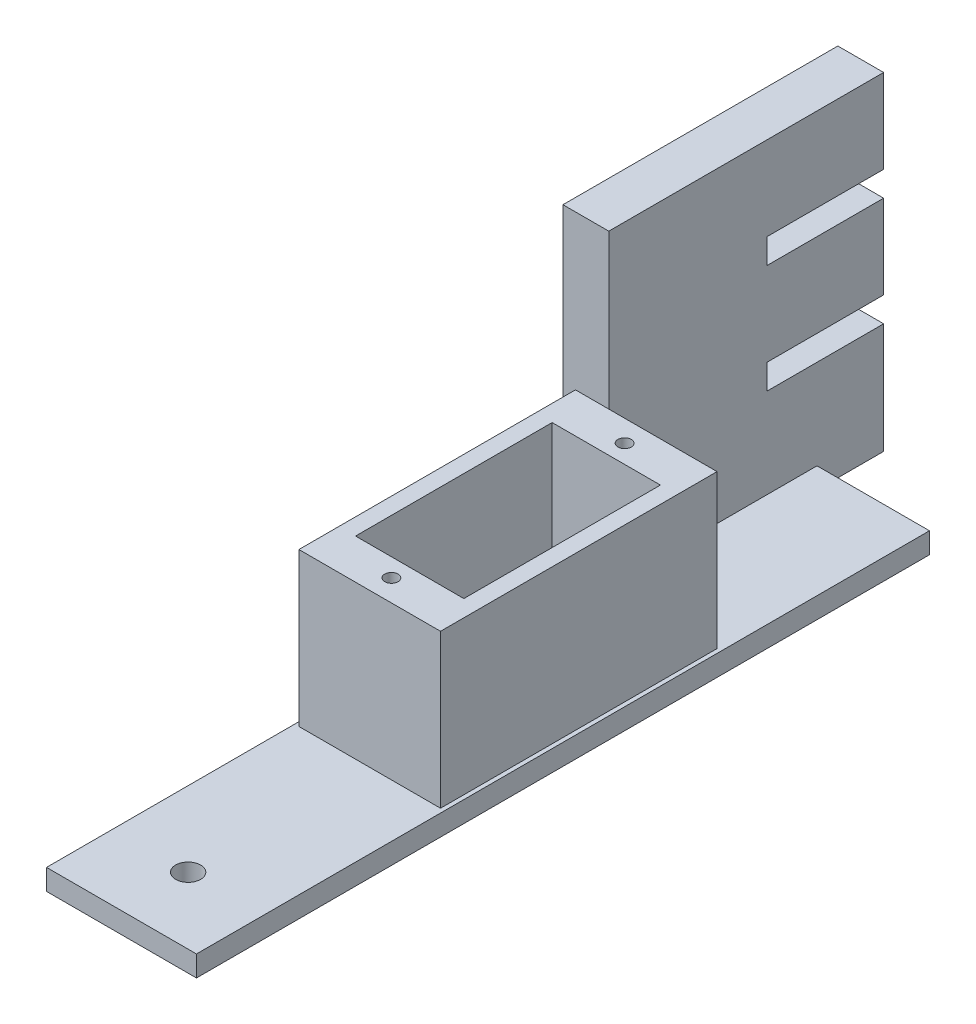
from build123d import *

# Parameters (mm, degrees)
S_BOX1_W       = 18
S_BOX1_H       = 2.5
BOSS_1_DEPTH   = 88
S_BOX2_W       = 17
S_BOX2_H       = 18.4
BOSS_2_DEPTH   = 33.2
S_BOX3_W       = 5.5
S_BOX3_H       = 39.4
BOSS_3_DEPTH   = 33
S_CUT4_W       = 13
S_CUT4_H       = 18.5
POCKET_4_DEPTH = 23.6
S_HOLE5_R      = 1.5
HOLE_5_DEPTH   = 2.7
S_HOLE6_R      = 0.8
HOLE_6_DEPTH   = 6.1
S_HOLE7_R      = 0.8
HOLE_7_DEPTH   = 6.1
S_CUT8_W       = 5.7
S_CUT8_H       = 3
POCKET_8_DEPTH = 14.1
S_CUT9_W       = 5.7
S_CUT9_H       = 3
POCKET_9_DEPTH = 14.1


with BuildPart() as part:
    # S_box1 → Boss_1 (new body)
    with BuildSketch(Plane.XY.offset(-80)):
        with Locations((0, -19.45)):
            Rectangle(S_BOX1_W, S_BOX1_H)
    extrude(amount=BOSS_1_DEPTH)

    # S_box2 → Boss_2 (add)
    with BuildSketch(Plane.XY.offset(-55)):
        with Locations((0, -9)):
            Rectangle(S_BOX2_W, S_BOX2_H)
    extrude(amount=BOSS_2_DEPTH)

    # S_box3 → Boss_3 (add)
    with BuildSketch(Plane.XY.offset(-88)):
        with Locations((-7.25, -1)):
            Rectangle(S_BOX3_W, S_BOX3_H)
    extrude(amount=BOSS_3_DEPTH)

    # S_cut4 → Pocket_4 (cut)
    with BuildSketch(Plane.XY.offset(-50.2)):
        with Locations((0, -8.95)):
            Rectangle(S_CUT4_W, S_CUT4_H)
    extrude(amount=POCKET_4_DEPTH, mode=Mode.SUBTRACT)

    # S_hole5 → Hole_5 (cut)
    with BuildSketch(Plane(origin=(0, -20.8, 0), x_dir=(1, 0, 0), z_dir=(0, 1, 0))):
        Circle(S_HOLE5_R)
    extrude(amount=HOLE_5_DEPTH, mode=Mode.SUBTRACT)

    # S_hole6 → Hole_6 (cut)
    with BuildSketch(Plane(origin=(0, -5.8, 0), x_dir=(1, 0, 0), z_dir=(0, 1, 0))):
        with Locations((0, 52.4)):
            Circle(S_HOLE6_R)
    extrude(amount=HOLE_6_DEPTH, mode=Mode.SUBTRACT)

    # S_hole7 → Hole_7 (cut)
    with BuildSketch(Plane(origin=(0, -5.8, 0), x_dir=(1, 0, 0), z_dir=(0, 1, 0))):
        with Locations((0, 24.4)):
            Circle(S_HOLE7_R)
    extrude(amount=HOLE_7_DEPTH, mode=Mode.SUBTRACT)

    # S_cut8 → Pocket_8 (cut)
    with BuildSketch(Plane.XY.offset(-88.1)):
        with Locations((-7.25, 7.13)):
            Rectangle(S_CUT8_W, S_CUT8_H)
    extrude(amount=POCKET_8_DEPTH, mode=Mode.SUBTRACT)

    # S_cut9 → Pocket_9 (cut)
    with BuildSketch(Plane.XY.offset(-88.1)):
        with Locations((-7.25, -5.93)):
            Rectangle(S_CUT9_W, S_CUT9_H)
    extrude(amount=POCKET_9_DEPTH, mode=Mode.SUBTRACT)


solid = part.part
